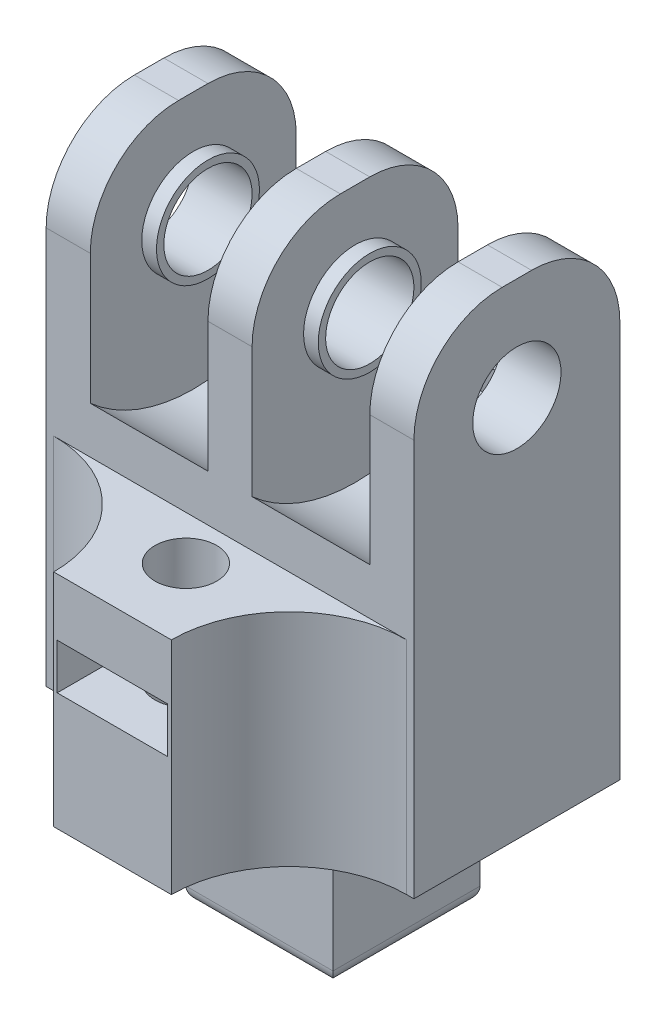
from build123d import *

# Parameters (mm, degrees)
SKETCH_1_W               = 3
SKETCH_1_H               = 18
EXTRUDE_2_DEPTH          = 7
CUT_EXTRUDE_1_DEPTH      = 32.591137998
CUT_EXTRUDE_1_DEPTH_BACK = 7.591137998
CUT_EXTRUDE_1_START      = -25
SKETCH_3_R               = 3
SKETCH_15_R              = 3.5
SKETCH_15_R_2            = 3
EXTRUDE_11_DEPTH         = 1
EXTRUDE_START            = 1
SKETCH_5_R               = 3.5
SKETCH_5_R_2             = 3
EXTRUDE_6_DEPTH          = 1
SKETCH_6_R               = 3.5
SKETCH_6_R_2             = 3
EXTRUDE_7_DEPTH          = 1
SKETCH_7_R               = 3.5
SKETCH_7_R_2             = 3
EXTRUDE_8_DEPTH          = 1
FILLET_1_R               = 6
SKETCH_8_W               = 10
SKETCH_8_H               = 10
EXTRUDE_9_DEPTH          = 10
FILLET_2_R               = 1
EXTRUDE_START_2          = -22
EXTRUDE_14_DEPTH         = 19
SKETCH_17_W              = 8
SKETCH_17_H              = 8
SKETCH_17_R              = 2.1
EXTRUDE_12_DEPTH         = 8
EXTRUDE_START_3          = -7
SKETCH_17_2_W            = 8
SKETCH_17_2_H            = 8
SKETCH_17_2_R            = 2.1
EXTRUDE_13_DEPTH         = 7
CUT_EXTRUDE_2_DEPTH      = 3.1
FILLET_4_R               = 8


with BuildPart() as part:
    # 草图1 → 凸台-拉伸2 (new, symmetric)
    with BuildSketch(Plane.XY):
        Polygon((3, 0), (0, 0), (0, -15), (25, -15), (25, 0), (22, 0), (14, 0), (11, 0), align=None)
        with Locations((12.5, 9)):
            Rectangle(SKETCH_1_W, SKETCH_1_H)
        with Locations((23.5, 9)):
            Rectangle(SKETCH_1_W, SKETCH_1_H)
        with Locations((1.5, 9)):
            Rectangle(SKETCH_1_W, SKETCH_1_H)
    extrude(amount=EXTRUDE_2_DEPTH, both=True)

    # 草图3 → 切除-拉伸1 (cut, two sides: drawn at the far end of the back side and taken through both)
    with BuildSketch(Plane(origin=(25, 0, 0), x_dir=(0, 0, -1), z_dir=(1, 0, 0)).offset(CUT_EXTRUDE_1_START - CUT_EXTRUDE_1_DEPTH_BACK)):
        with Locations(Location((0, 11, 0), (0, 0, 90))):
            Circle(SKETCH_3_R)
    extrude(amount=CUT_EXTRUDE_1_DEPTH + CUT_EXTRUDE_1_DEPTH_BACK, mode=Mode.SUBTRACT)

    # 草图15 → 凸台-拉伸11 (add)
    with BuildSketch(Plane(origin=(3, 0, 0), x_dir=(0, 0, -1), z_dir=(1, 0, 0))):
        with Locations(Location((0, 11, 0), (0, 0, 180))):
            Circle(SKETCH_15_R)
        with Locations(Location((0, 11, 0), (0, 0, 90))):
            Circle(SKETCH_15_R_2, mode=Mode.SUBTRACT)
    extrude(amount=EXTRUDE_11_DEPTH)

    # 草图5 → 凸台-拉伸6 (add)
    with BuildSketch(Plane.ZY.offset(-11).offset(EXTRUDE_START)):
        with Locations((0, 11)):
            Circle(SKETCH_5_R)
        with Locations(Location((0, 11, 0), (0, 0, 90))):
            Circle(SKETCH_5_R_2, mode=Mode.SUBTRACT)
    extrude(amount=-EXTRUDE_6_DEPTH)

    # 草图6 → 凸台-拉伸7 (add)
    with BuildSketch(Plane(origin=(14, 0, 0), x_dir=(0, 0, -1), z_dir=(1, 0, 0))):
        with Locations(Location((0, 11, 0), (0, 0, 180))):
            Circle(SKETCH_6_R)
        with Locations(Location((0, 11, 0), (0, 0, 90))):
            Circle(SKETCH_6_R_2, mode=Mode.SUBTRACT)
    extrude(amount=EXTRUDE_7_DEPTH)

    # 草图7 → 凸台-拉伸8 (add)
    with BuildSketch(Plane.ZY.offset(-22).offset(EXTRUDE_START)):
        with Locations((0, 11)):
            Circle(SKETCH_7_R)
        with Locations(Location((0, 11, 0), (0, 0, 90))):
            Circle(SKETCH_7_R_2, mode=Mode.SUBTRACT)
    extrude(amount=-EXTRUDE_8_DEPTH)

    # 圆角1
    fillet_1_edges = [part.edges().sort_by_distance(p)[0] for p in [
        (23.5, 18, 7),
        (1.5, 18, -7),
        (12.5, 18, -7),
        (23.5, 18, -7),
        (12.5, 18, 7),
        (1.5, 18, 7),
    ]]
    fillet(fillet_1_edges, radius=FILLET_1_R)

    # 草图8 → 凸台-拉伸9 (add)
    with BuildSketch(Plane.XZ.offset(15)):
        with Locations((12.5, 0)):
            Rectangle(SKETCH_8_W, SKETCH_8_H)
    extrude(amount=EXTRUDE_9_DEPTH)

    # 圆角2
    fillet_2_edges = [part.edges().sort_by_distance(p)[0] for p in [
        (12.5, -25, 5),
        (7.5, -25, 0),
        (12.5, -25, -5),
        (17.5, -25, 0),
    ]]
    fillet(fillet_2_edges, radius=FILLET_2_R)

    # 草图23 → 凸台-拉伸14 (add)
    with BuildSketch(Plane.ZY.offset(EXTRUDE_START_2)):
        with BuildLine():
            Line((-7, -7), (7, -7))
            Line((7, -7), (7, 3.173762079))
            ThreePointArc((7, 3.173762079), (0, 0.5), (-7, 3.173762079))
            Line((-7, 3.173762079), (-7, -7))
        make_face()
    extrude(amount=EXTRUDE_14_DEPTH)

    # 草图17 → 凸台-拉伸12 (add)
    with BuildSketch(Plane(origin=(0, -7, 0), x_dir=(-1, 0, 0), z_dir=(0, -1, 0))):
        with Locations((-12.51246086, 11)):
            Rectangle(SKETCH_17_W, SKETCH_17_H)
        with Locations(Location((-12.5, 10, 0), (0, 0, 270))):
            Circle(SKETCH_17_R, mode=Mode.SUBTRACT)
    extrude_12 = extrude(amount=EXTRUDE_12_DEPTH)

    # 草图17<2> → 凸台-拉伸13 (add)
    with BuildSketch(Plane(origin=(0, -7, 0), x_dir=(-1, 0, 0), z_dir=(0, -1, 0)).offset(EXTRUDE_START_3)):
        with Locations((-12.51246086, 11)):
            Rectangle(SKETCH_17_2_W, SKETCH_17_2_H)
        with Locations(Location((-12.5, 10, 0), (0, 0, 270))):
            Circle(SKETCH_17_2_R, mode=Mode.SUBTRACT)
    extrude_13 = extrude(amount=EXTRUDE_13_DEPTH)

    # 草图18 → 切除-拉伸2 (cut)
    with BuildSketch(Plane(origin=(0, -7, 0), x_dir=(-1, 0, 0), z_dir=(0, -1, 0))):
        Polygon((-8.75, 15), (-8.75, 12.165063509), (-12.5, 14.330127019), (-16.25, 12.165063509), (-16.25, 15), align=None)
        Polygon((-8.75, 7.834936491), (-8.75, 12.165063509), (-12.5, 14.330127019), (-16.25, 12.165063509), (-16.25, 7.834936491), (-12.5, 5.669872981), align=None)
    cut_extrude_2 = extrude(amount=-CUT_EXTRUDE_2_DEPTH, mode=Mode.SUBTRACT)

    # 镜向1: 凸台-拉伸12, 凸台-拉伸13, 切除-拉伸2 across plane
    add(extrude_12.mirror(Plane.XY))
    add(extrude_13.mirror(Plane.XY))
    add(cut_extrude_2.mirror(Plane.XY), mode=Mode.SUBTRACT)

    # 圆角4
    fillet_4_edges = [part.edges().sort_by_distance(p)[0] for p in [
        (8.51246086, -7.5, -7),
        (16.51246086, -7.5, -7),
        (16.51246086, -7.5, 7),
        (8.51246086, -7.5, 7),
    ]]
    fillet(fillet_4_edges, radius=FILLET_4_R - 0.0001)  # a hair under: the kernel refuses the full size


solid = part.part
